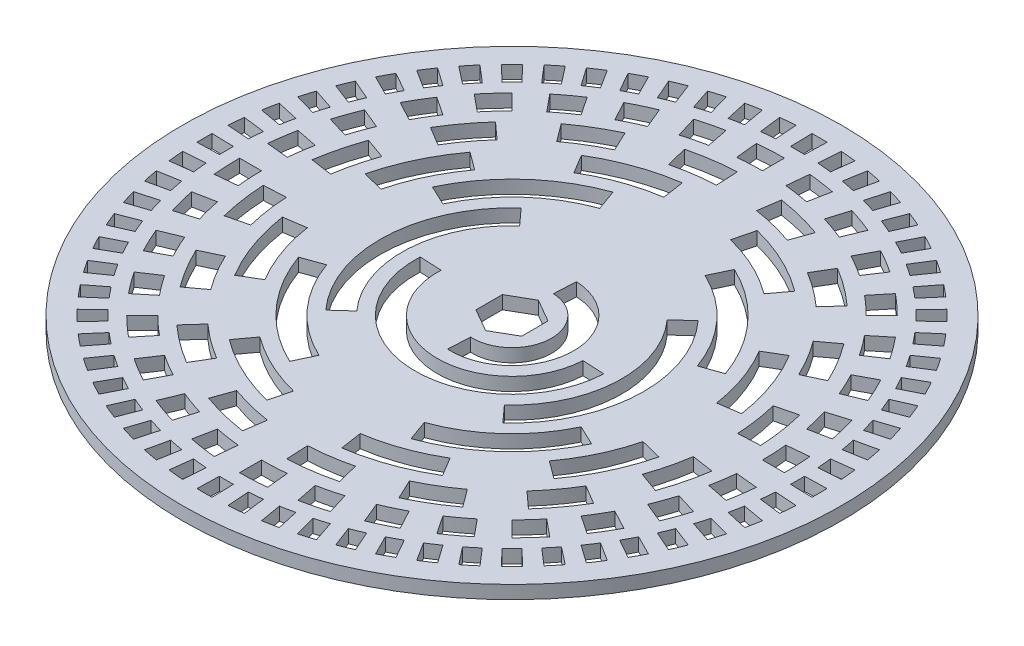
from build123d import *

# Parameters (mm, degrees)
SKETCH1_R           = 75
BOSS_EXTRUDE1_DEPTH = 3
CUT_EXTRUDE1_DEPTH  = 107.108435103
CIRPATTERN1_COUNT   = 64
CUT_EXTRUDE2_DEPTH  = 107.108435103
CIRPATTERN2_COUNT   = 32
CUT_EXTRUDE3_DEPTH  = 107.108435103
CIRPATTERN3_COUNT   = 16
CUT_EXTRUDE4_DEPTH  = 107.108435103
CIRPATTERN4_COUNT   = 8
CUT_EXTRUDE5_DEPTH  = 107.108435103
CIRPATTERN5_COUNT   = 4
CUT_EXTRUDE6_DEPTH  = 107.108435103
CIRPATTERN6_COUNT   = 2
CUT_EXTRUDE7_DEPTH  = 107.108435103
CUT_EXTRUDE8_DEPTH  = 107.108435103
CUT_EXTRUDE9_DEPTH  = 107.108435103


with BuildPart() as part:
    # Sketch1 → Boss-Extrude1 (new body)
    with BuildSketch(Plane(origin=(0, 0, 0), x_dir=(1, 0, 0), z_dir=(0, 1, 0))):
        Circle(SKETCH1_R)
    extrude(amount=BOSS_EXTRUDE1_DEPTH)

    # Sketch2 → Cut-Extrude1 (cut, through all)
    with BuildSketch(Plane(origin=(0, 3, 0), x_dir=(1, 0, 0), z_dir=(0, 1, 0))):
        with BuildLine():
            Line((1.717885997, 69.978917309), (1.595179854, 64.980423215))
            ThreePointArc((1.595179854, 64.980423215), (0, 65), (-1.595179854, 64.980423215))
            Line((-1.595179854, 64.980423215), (-1.717885997, 69.978917309))
            ThreePointArc((-1.717885997, 69.978917309), (0, 70), (1.717885997, 69.978917309))
        make_face()
    cut_extrude1 = extrude(amount=-CUT_EXTRUDE1_DEPTH, mode=Mode.SUBTRACT)

    # CirPattern1: Cut-Extrude1 ×64 about axis
    cirpattern1_axis = Axis((0, 3, 0), (0, -1, 0))
    for i in range(1, CIRPATTERN1_COUNT):
        add(cut_extrude1.rotate(cirpattern1_axis, i * 360 / CIRPATTERN1_COUNT), mode=Mode.SUBTRACT)

    # Sketch3 → Cut-Extrude2 (cut, through all)
    with BuildSketch(Plane(origin=(0, 3, 0), x_dir=(1, 0, 0), z_dir=(0, 1, 0))):
        with BuildLine():
            Line((0, 62), (0, 57))
            ThreePointArc((0, 57), (-2.796857437, 56.931341004), (-5.586976999, 56.72552942))
            Line((-5.586976999, 56.72552942), (-6.0770627, 61.701453054))
            ThreePointArc((-6.0770627, 61.701453054), (-3.042195808, 61.925318285), (0, 62))
        make_face()
    cut_extrude2 = extrude(amount=-CUT_EXTRUDE2_DEPTH, mode=Mode.SUBTRACT)

    # CirPattern2: Cut-Extrude2 ×32 about axis
    cirpattern2_axis = Axis((0, 3, 0), (0, -1, 0))
    for i in range(1, CIRPATTERN2_COUNT):
        add(cut_extrude2.rotate(cirpattern2_axis, i * 360 / CIRPATTERN2_COUNT), mode=Mode.SUBTRACT)

    # Sketch5 → Cut-Extrude3 (cut, through all)
    with BuildSketch(Plane(origin=(0, 3, 0), x_dir=(1, 0, 0), z_dir=(0, 1, 0))):
        with BuildLine():
            Line((-2.404316042, 48.940977354), (-2.649654414, 53.934954635))
            ThreePointArc((-2.649654414, 53.934954635), (-7.923445621, 53.415531538), (-13.120929715, 52.381687673))
            Line((-13.120929715, 52.381687673), (-11.906028815, 47.531531407))
            ThreePointArc((-11.906028815, 47.531531407), (-7.189793248, 48.469648988), (-2.404316042, 48.940977354))
        make_face()
    cut_extrude3 = extrude(amount=-CUT_EXTRUDE3_DEPTH, mode=Mode.SUBTRACT)

    # CirPattern3: Cut-Extrude3 ×16 about axis
    cirpattern3_axis = Axis((0, 3, 0), (0, -1, 0))
    for i in range(1, CIRPATTERN3_COUNT):
        add(cut_extrude3.rotate(cirpattern3_axis, i * 360 / CIRPATTERN3_COUNT), mode=Mode.SUBTRACT)

    # Sketch6 → Cut-Extrude4 (cut, through all)
    with BuildSketch(Plane(origin=(0, 3, 0), x_dir=(1, 0, 0), z_dir=(0, 1, 0))):
        with BuildLine():
            Line((-23.648726233, 39.45551606), (-21.078212512, 35.16687301))
            ThreePointArc((-21.078212512, 35.16687301), (-13.812483989, 38.603306673), (-6.015949453, 40.556236909))
            Line((-6.015949453, 40.556236909), (-6.749601825, 45.502119458))
            ThreePointArc((-6.749601825, 45.502119458), (-15.496933256, 43.311026998), (-23.648726233, 39.45551606))
        make_face()
    cut_extrude4 = extrude(amount=-CUT_EXTRUDE4_DEPTH, mode=Mode.SUBTRACT)

    # CirPattern4: Cut-Extrude4 ×8 about axis
    cirpattern4_axis = Axis((0, 3, 0), (0, -1, 0))
    for i in range(1, CIRPATTERN4_COUNT):
        add(cut_extrude4.rotate(cirpattern4_axis, i * 360 / CIRPATTERN4_COUNT), mode=Mode.SUBTRACT)

    # Sketch7 → Cut-Extrude5 (cut, through all)
    with BuildSketch(Plane(origin=(0, 3, 0), x_dir=(1, 0, 0), z_dir=(0, 1, 0))):
        with BuildLine():
            Line((-12.801814429, 35.778674477), (-11.117365162, 31.070954151))
            ThreePointArc((-11.117365162, 31.070954151), (-22.16144551, 24.451387137), (-29.831646673, 14.109318083))
            Line((-29.831646673, 14.109318083), (-34.351593139, 16.24709355))
            ThreePointArc((-34.351593139, 16.24709355), (-25.519240284, 28.156142763), (-12.801814429, 35.778674477))
        make_face()
    cut_extrude5 = extrude(amount=-CUT_EXTRUDE5_DEPTH, mode=Mode.SUBTRACT)

    # CirPattern5: Cut-Extrude5 ×4 about axis
    cirpattern5_axis = Axis((0, 3, 0), (0, -1, 0))
    for i in range(1, CIRPATTERN5_COUNT):
        add(cut_extrude5.rotate(cirpattern5_axis, i * 360 / CIRPATTERN5_COUNT), mode=Mode.SUBTRACT)

    # Sketch9 → Cut-Extrude6 (cut, through all)
    with BuildSketch(Plane(origin=(0, 3, 0), x_dir=(1, 0, 0), z_dir=(0, 1, 0))):
        with BuildLine():
            Line((-16.788973871, 18.523778134), (-20.146768645, 22.228533761))
            ThreePointArc((-20.146768645, 22.228533761), (-29.963863686, 1.47203023), (-22.228533761, -20.146768645))
            Line((-22.228533761, -20.146768645), (-18.523778134, -16.788973871))
            ThreePointArc((-18.523778134, -16.788973871), (-24.969886405, 1.226691858), (-16.788973871, 18.523778134))
        make_face()
    cut_extrude6 = extrude(amount=-CUT_EXTRUDE6_DEPTH, mode=Mode.SUBTRACT)

    # CirPattern6: Cut-Extrude6 ×2 about axis
    cirpattern6_axis = Axis((0, 3, 0), (0, -1, 0))
    for i in range(1, CIRPATTERN6_COUNT):
        add(cut_extrude6.rotate(cirpattern6_axis, i * 360 / CIRPATTERN6_COUNT), mode=Mode.SUBTRACT)

    # Sketch10 → Cut-Extrude7 (cut, through all)
    with BuildSketch(Plane(origin=(0, 3, 0), x_dir=(1, 0, 0), z_dir=(0, 1, 0))):
        with BuildLine():
            Line((16.979522755, -0.834150464), (21.973500037, -1.079488835))
            ThreePointArc((21.973500037, -1.079488835), (-1.079488835, -21.973500037), (-21.973500037, 1.079488835))
            Line((-21.973500037, 1.079488835), (-16.979522755, 0.834150464))
            ThreePointArc((-16.979522755, 0.834150464), (-0.834150464, -16.979522755), (16.979522755, -0.834150464))
        make_face()
    extrude(amount=-CUT_EXTRUDE7_DEPTH, mode=Mode.SUBTRACT)

    # Sketch11 → Cut-Extrude8 (cut, through all)
    with BuildSketch(Plane(origin=(0, 3, 0), x_dir=(1, 0, 0), z_dir=(0, 1, 0))):
        with BuildLine():
            Line((0.441609069, 8.989159106), (0.686947441, 13.983136387))
            ThreePointArc((0.686947441, 13.983136387), (13.983136387, -0.686947441), (-0.686947441, -13.983136387))
            Line((-0.686947441, -13.983136387), (-0.441609069, -8.989159106))
            ThreePointArc((-0.441609069, -8.989159106), (8.989159106, -0.441609069), (0.441609069, 8.989159106))
        make_face()
    extrude(amount=-CUT_EXTRUDE8_DEPTH, mode=Mode.SUBTRACT)

    # Sketch19 → Cut-Extrude9 (cut, through all)
    with BuildSketch(Plane(origin=(0, 3, 0), x_dir=(1, 0, 0), z_dir=(0, 1, 0))):
        Polygon((5.196152423, -3), (5.196152423, 3), (0, 6), (-5.196152423, 3), (-5.196152423, -3), (0, -6), align=None)
    extrude(amount=-CUT_EXTRUDE9_DEPTH, mode=Mode.SUBTRACT)


solid = part.part
